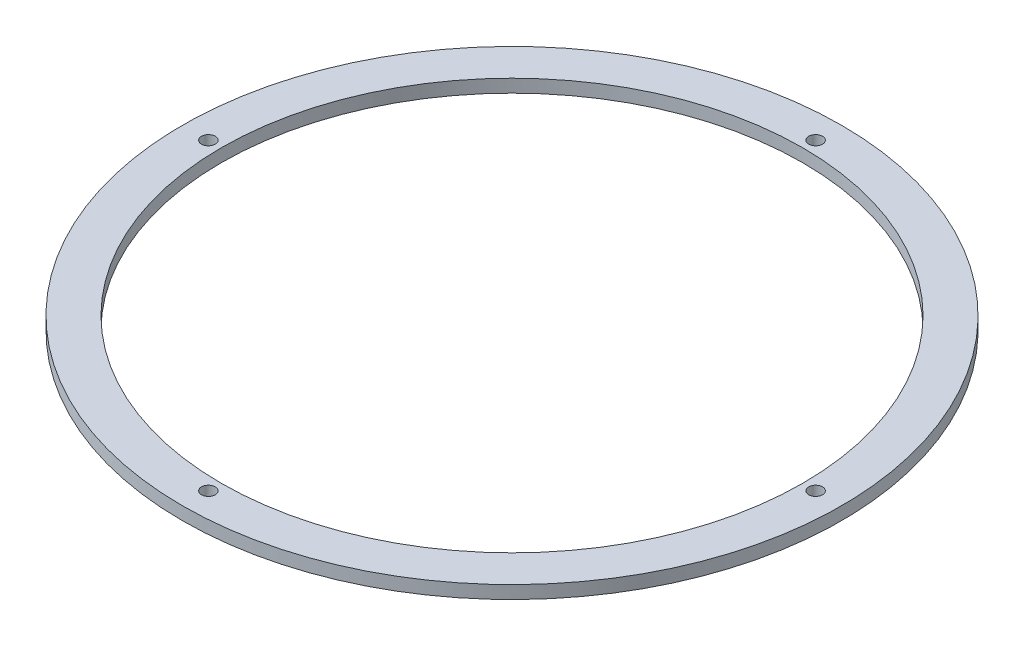
from build123d import *

# Parameters (mm, degrees)
SKETCH1_R               = 161.4
SKETCH1_R_2             = 142.35
BOSS_EXTRUDE1_DEPTH     = 6.35
F_1_4_CLEARANCE_HOLE1_D = 6.7564
CIRPATTERN1_COUNT       = 4


with BuildPart() as part:
    # Sketch1 → Boss-Extrude1 (new body)
    with BuildSketch(Plane(origin=(0, 0, 0), x_dir=(1, 0, 0), z_dir=(0, 1, 0))):
        Circle(SKETCH1_R)
        Circle(SKETCH1_R_2, mode=Mode.SUBTRACT)
    extrude(amount=BOSS_EXTRUDE1_DEPTH)

    # 1/4 Clearance Hole1 (through all)
    with Locations(Plane(origin=(0, 6.35, 0), x_dir=(1, 0, 0), z_dir=(0, 1, 0))):
        with Locations((0, -148.7)):
            f_1_4_clearance_hole1 = Hole(F_1_4_CLEARANCE_HOLE1_D / 2)

    # CirPattern1: 1/4 Clearance Hole1 ×4 about axis
    cirpattern1_axis = Axis((0, 6.35, 0), (0, -1, 0))
    for i in range(1, CIRPATTERN1_COUNT):
        add(f_1_4_clearance_hole1.rotate(cirpattern1_axis, i * 360 / CIRPATTERN1_COUNT), mode=Mode.SUBTRACT)


solid = part.part
